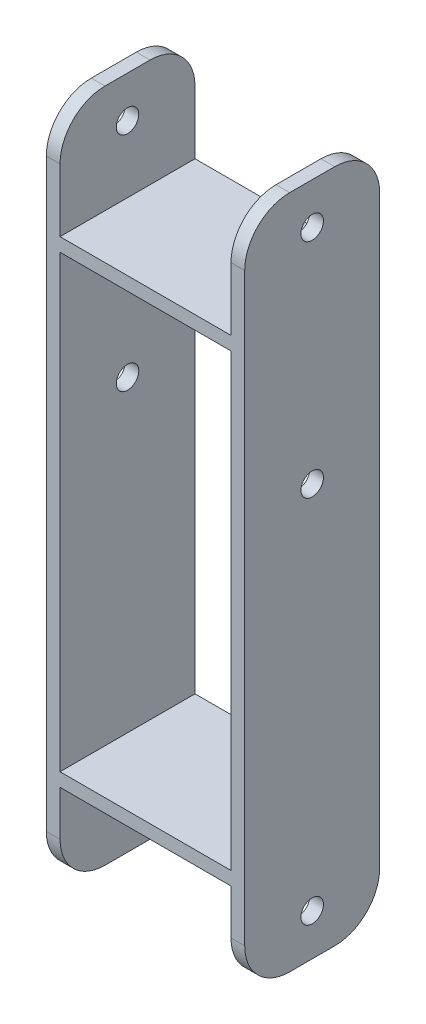
from build123d import *

# Parameters (mm, degrees)
SKETCH1_W           = 38
SKETCH1_H           = 100
BOSS_EXTRUDE1_DEPTH = 15
FILLET1_R           = 10
SKETCH2_R           = 2.5
CUT_EXTRUDE1_DEPTH  = 61
SKETCH3_R           = 2.5
CUT_EXTRUDE2_DEPTH  = 55


with BuildPart() as part:
    # Sketch1 → Boss-Extrude1 (new, symmetric)
    with BuildSketch(Plane.XY):
        Polygon((-19, 100), (-22.047619048, 100), (-22.047619048, -50), (-19, -50), (-19, -30), (19, -30), (19, -50), (22.047619048, -50), (22.047619048, 100), (19, 100), (19, 76), (-19, 76), align=None)
        with Locations((0, 23)):
            Rectangle(SKETCH1_W, SKETCH1_H, mode=Mode.SUBTRACT)
    extrude(amount=BOSS_EXTRUDE1_DEPTH, both=True)

    # Fillet1
    fillet1_edges = [part.edges().sort_by_distance(p)[0] for p in [
        (-20.523809524, -50, -15),
        (20.523809524, -50, -15),
        (20.523809524, -50, 15),
        (-20.523809524, -50, 15),
        (-20.523809524, 100, 15),
        (-20.523809524, 100, -15),
        (20.523809524, 100, -15),
        (20.523809524, 100, 15),
    ]]
    fillet(fillet1_edges, radius=FILLET1_R)

    # Sketch2 → Cut-Extrude1 (cut)
    with BuildSketch(Plane(origin=(22.047619048, 0, 0), x_dir=(0, 0, -1), z_dir=(1, 0, 0))):
        with Locations((0, 41.439583657)):
            Circle(SKETCH2_R)
        with Locations((0, -40.747770908)):
            Circle(SKETCH2_R)
    extrude(amount=-CUT_EXTRUDE1_DEPTH, mode=Mode.SUBTRACT)

    # Sketch3 → Cut-Extrude2 (cut)
    with BuildSketch(Plane(origin=(22.047619048, 0, 0), x_dir=(0, 0, -1), z_dir=(1, 0, 0))):
        with Locations((0, 90.824457964)):
            Circle(SKETCH3_R)
    extrude(amount=-CUT_EXTRUDE2_DEPTH, mode=Mode.SUBTRACT)


solid = part.part
